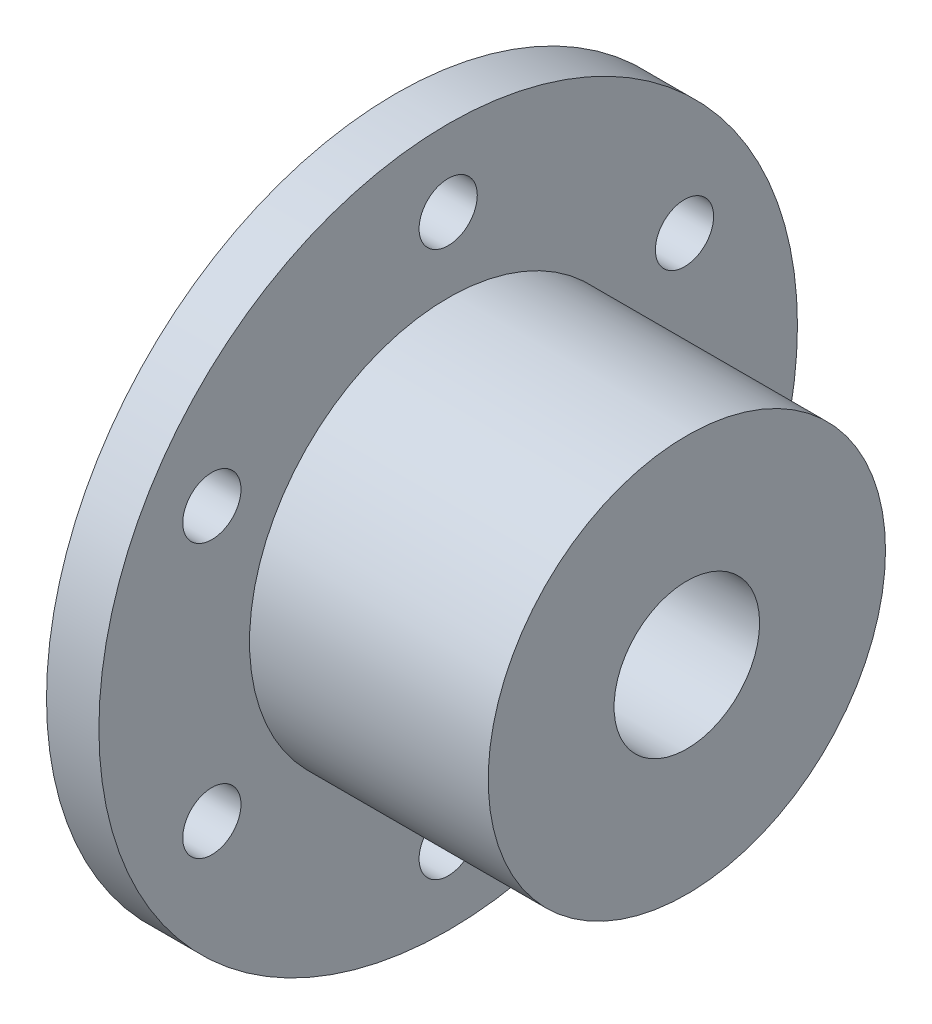
from build123d import *

# Parameters (mm, degrees)
SKETCH1_R           = 30.48
SKETCH1_R_2         = 6.35
SKETCH1_R_3         = 2.54
BOSS_EXTRUDE1_DEPTH = 12.7
SKETCH2_OUTSIDE_W   = 80.934
SKETCH2_OUTSIDE_H   = 80.934
SKETCH2_OUTSIDE_R   = 17.3355
CUT_EXTRUDE1_DEPTH  = 20.828


with BuildPart() as part:
    # Sketch1 → Boss-Extrude1 (new, symmetric)
    with BuildSketch(Plane(origin=(0, 0, 0), x_dir=(0, 0, -1), z_dir=(1, 0, 0))):
        Circle(SKETCH1_R)
        Circle(SKETCH1_R_2, mode=Mode.SUBTRACT)
        with Locations((0, 23.8125)):
            Circle(SKETCH1_R_3, mode=Mode.SUBTRACT)
        with Locations((20.622229928, 11.90625)):
            Circle(SKETCH1_R_3, mode=Mode.SUBTRACT)
        with Locations((20.622229928, -11.90625)):
            Circle(SKETCH1_R_3, mode=Mode.SUBTRACT)
        with Locations((0, -23.8125)):
            Circle(SKETCH1_R_3, mode=Mode.SUBTRACT)
        with Locations((-20.622229928, -11.90625)):
            Circle(SKETCH1_R_3, mode=Mode.SUBTRACT)
        with Locations((-20.622229928, 11.90625)):
            Circle(SKETCH1_R_3, mode=Mode.SUBTRACT)
    extrude(amount=BOSS_EXTRUDE1_DEPTH, both=True)

    # Sketch2 outside → Cut-Extrude1 (cut)
    with BuildSketch(Plane(origin=(12.7, 0, 0), x_dir=(0, 0, -1), z_dir=(1, 0, 0))):
        Rectangle(SKETCH2_OUTSIDE_W, SKETCH2_OUTSIDE_H)
        Circle(SKETCH2_OUTSIDE_R, mode=Mode.SUBTRACT)
    extrude(amount=-CUT_EXTRUDE1_DEPTH, mode=Mode.SUBTRACT)


solid = part.part
